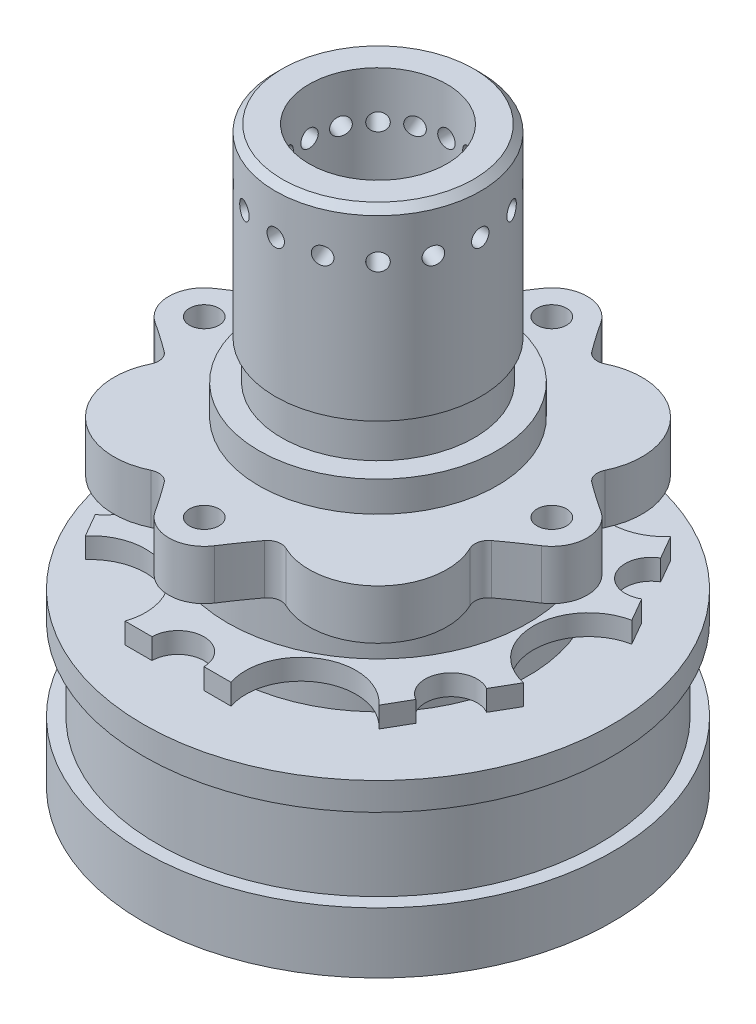
from build123d import *

# Parameters (mm, degrees)
SKETCH5_W                     = 15.875
SKETCH5_H                     = 132.08
SKETCH7_W                     = 3.4
SKETCH7_H                     = 69.85
DRIVE_PIN_HOLES_PATTERN_COUNT = 4
FLANGE_SUPPORT_CUT_REACH      = 105.468
SKETCH8_R                     = 52.5
BRAKE_START                   = 4.7625
BRAKE_HAT_HEX_DEPTH           = 4.7625
SKETCH14_R                    = 2
PIN_HOLES_DEPTH               = 104.467984179
PIN_HOLE_PATTERN_COUNT        = 16
FILLET1_R                     = 3.175
SKETCH17_R                    = 8.73125
CUT_EXTRUDE1_DEPTH            = 7.9375
SKETCH18_R                    = 6.746875
CUT_EXTRUDE2_DEPTH            = 1.27
CIRPATTERN2_COUNT             = 3
CUT_EXTRUDE3_DEPTH            = 34.29
FILLET2_R                     = 6.35


with BuildPart() as part:
    # Sketch1 → Bearing Shaft/Flange Support (revolve)
    with BuildSketch(Plane(origin=(0, 0, 0), x_dir=(0, 0, -1), z_dir=(1, 0, 0)), mode=Mode.PRIVATE) as bearing_shaft_flange_support_sk:
        Polygon((0, 0), (-34.6075, 0), (-34.6075, -12.319), (-47.625, -12.319), (-47.625, -17.0815), (-34.6075, -17.0815), (-34.6075, -22.86), (-53.975, -22.86), (-53.975, -29.21), (-50.8, -29.21), (-50.8, -48.26), (-53.975, -48.26), (-53.975, -62.23), (0, -62.23), align=None)
    revolve(bearing_shaft_flange_support_sk.sketch.rotate(Axis((0, 0, 0), (0, 1, 0)), 180), axis=Axis((0, 0, 0), (0, 1, 0)))

    # Sketch2 → Drive Pin Support (revolve)
    with BuildSketch(Plane(origin=(0, 0, 0), x_dir=(0, 0, -1), z_dir=(1, 0, 0)), mode=Mode.PRIVATE) as drive_pin_support_sk:
        Polygon((0, 0), (-52.5, 0), (-52.5, 11.43), (-27.4096, 11.43), (-27.4096, 18.43), (-22.225, 18.43), (-22.225, 27.305), (-23.61946, 27.305), (-23.61946, 68.2625), (-22.03196, 69.85), (0, 69.85), align=None)
    revolve(drive_pin_support_sk.sketch.rotate(Axis((0, 0, 0), (0, 1, 0)), 180), axis=Axis((0, 0, 0), (0, 1, 0)))

    # Sketch5 → Center Mass Removal (revolve, cut)
    with BuildSketch(Plane(origin=(0, 0, 0), x_dir=(0, 0, -1), z_dir=(1, 0, 0)), mode=Mode.PRIVATE) as center_mass_removal_sk:
        with Locations((7.9375, 3.81)):
            Rectangle(SKETCH5_W, SKETCH5_H)
    revolve(center_mass_removal_sk.sketch.rotate(Axis((0, 0, 0), (0, -1, 0)), 180), axis=Axis((0, 0, 0), (0, -1, 0)), mode=Mode.SUBTRACT)

    # Sketch7 → Drive Pin Holes (revolve, cut)
    with BuildSketch(Plane(origin=(0, 0, 40), x_dir=(0, 0, -1), z_dir=(1, 0, 0))):
        with Locations((1.7, 34.925)):
            Rectangle(SKETCH7_W, SKETCH7_H)
    drive_pin_holes = revolve(axis=Axis((0, -6.35, 40), (0, 1, 0)), mode=Mode.SUBTRACT)

    # Drive Pin Holes Pattern: Drive Pin Holes ×4 about axis
    drive_pin_holes_pattern_axis = Axis((0, 0, 0), (0, 1, 0))
    for i in range(1, DRIVE_PIN_HOLES_PATTERN_COUNT):
        add(drive_pin_holes.rotate(drive_pin_holes_pattern_axis, i * 360 / DRIVE_PIN_HOLES_PATTERN_COUNT), mode=Mode.SUBTRACT)

    # Sketch8 → Flange Support Cut (cut, up to next)
    with BuildSketch(Plane.XZ, mode=Mode.PRIVATE) as flange_support_cut_sk1:
        Circle(SKETCH8_R)
        with BuildLine():
            ThreePointArc((6.851776468, 44.436165629), (0, 48.1625), (-6.851776468, 44.436165629))
            ThreePointArc((-6.851776468, 44.436165629), (-9.964767607, 39.850591878), (-13.274865482, 35.405206349))
            ThreePointArc((-13.274865482, 35.405206349), (-33.675960454, 33.675960454), (-35.405206349, 13.274865482))
            ThreePointArc((-35.405206349, 13.274865482), (-39.850591878, 9.964767607), (-44.436165629, 6.851776468))
            ThreePointArc((-44.436165629, 6.851776468), (-48.1625, 0), (-44.436165629, -6.851776468))
            ThreePointArc((-44.436165629, -6.851776468), (-39.850591878, -9.964767607), (-35.405206349, -13.274865482))
            ThreePointArc((-35.405206349, -13.274865482), (-33.675960454, -33.675960454), (-13.274865482, -35.405206349))
            ThreePointArc((-13.274865482, -35.405206349), (-9.964767607, -39.850591878), (-6.851776468, -44.436165629))
            ThreePointArc((-6.851776468, -44.436165629), (0, -48.1625), (6.851776468, -44.436165629))
            ThreePointArc((6.851776468, -44.436165629), (9.964767607, -39.850591878), (13.274865482, -35.405206349))
            ThreePointArc((13.274865482, -35.405206349), (33.675960454, -33.675960454), (35.405206349, -13.274865482))
            ThreePointArc((35.405206349, -13.274865482), (39.850591878, -9.964767607), (44.436165629, -6.851776468))
            ThreePointArc((44.436165629, -6.851776468), (48.1625, 0), (44.436165629, 6.851776468))
            ThreePointArc((44.436165629, 6.851776468), (39.850591878, 9.964767607), (35.405206349, 13.274865482))
            ThreePointArc((35.405206349, 13.274865482), (33.675960454, 33.675960454), (13.274865482, 35.405206349))
            ThreePointArc((13.274865482, 35.405206349), (9.964767607, 39.850591878), (6.851776468, 44.436165629))
        make_face(mode=Mode.SUBTRACT)
    flange_support_cut_tool1 = extrude(flange_support_cut_sk1.sketch, amount=-FLANGE_SUPPORT_CUT_REACH, mode=Mode.PRIVATE) & part.part
    add(flange_support_cut_tool1.solids().sort_by_distance((-51.015076, 0, 0))[0], mode=Mode.SUBTRACT)

    # Sketch10 → Brake Hat Hex (cut)
    with BuildSketch(Plane.XZ.offset(12.319).offset(BRAKE_START)):
        with BuildLine():
            ThreePointArc((5.969, -46.0375), (0.002019456, -40.068500342), (-5.968998634, -46.033461088))
            Line((-5.968998634, -46.033461088), (-12.209057508, -46.033461088))
            ThreePointArc((-12.209057508, -46.033461088), (-0.007882397, -47.624999348), (12.193818875, -46.0375))
            Line((12.193818875, -46.0375), (5.969, -46.0375))
        make_face()
        with BuildLine():
            ThreePointArc((-33.772735089, -33.578906915), (-23.81932603, -41.240518092), (-12.209057508, -46.033461088))
            ThreePointArc((-12.209057508, -46.033461088), (-17.890731283, -30.975814606), (-33.772735089, -33.578906915))
        make_face()
        with BuildLine():
            ThreePointArc((-45.970675481, -12.443376586), (-41.248400489, -23.805673317), (-33.772735089, -33.578906915))
            Line((-33.772735089, -33.578906915), (-36.885144527, -28.188055635))
            ThreePointArc((-36.885144527, -28.188055635), (-34.699329459, -20.035999071), (-42.850646043, -17.847426092))
            Line((-42.850646043, -17.847426092), (-45.970675481, -12.443376586))
        make_face()
        with BuildLine():
            ThreePointArc((33.761617972, -33.590084503), (17.88047671, -30.981735086), (12.193818875, -46.0375))
            ThreePointArc((12.193818875, -46.0375), (23.805673317, -41.248400489), (33.761617972, -33.590084503))
        make_face()
        with BuildLine():
            ThreePointArc((-45.966553964, 12.458593085), (-47.624999348, 0.007882397), (-45.970675481, -12.443376586))
            ThreePointArc((-45.970675481, -12.443376586), (-35.771207993, 0.005920481), (-45.966553964, 12.458593085))
        make_face()
        with BuildLine():
            Line((36.88164741, -28.186034996), (33.761617972, -33.590084503))
            ThreePointArc((33.761617972, -33.590084503), (41.240518092, -23.81932603), (45.966553964, -12.458593085))
            Line((45.966553964, -12.458593085), (42.854144527, -17.849444365))
            ThreePointArc((42.854144527, -17.849444365), (34.701348915, -20.032501271), (36.88164741, -28.186034996))
        make_face()
        with BuildLine():
            ThreePointArc((-33.761617972, 33.590084503), (-41.240518092, 23.81932603), (-45.966553964, 12.458593085))
            Line((-45.966553964, 12.458593085), (-42.854144527, 17.849444365))
            ThreePointArc((-42.854144527, 17.849444365), (-34.701348915, 20.032501271), (-36.88164741, 28.186034996))
            Line((-36.88164741, 28.186034996), (-33.761617972, 33.590084503))
        make_face()
        with BuildLine():
            ThreePointArc((45.970675481, 12.443376586), (35.771207993, -0.005920481), (45.966553964, -12.458593085))
            ThreePointArc((45.966553964, -12.458593085), (47.624999348, -0.007882397), (45.970675481, 12.443376586))
        make_face()
        with BuildLine():
            ThreePointArc((-12.193818875, 46.0375), (-23.805673317, 41.248400489), (-33.761617972, 33.590084503))
            ThreePointArc((-33.761617972, 33.590084503), (-17.88047671, 30.981735086), (-12.193818875, 46.0375))
        make_face()
        with BuildLine():
            Line((42.850646043, 17.847426092), (45.970675481, 12.443376586))
            ThreePointArc((45.970675481, 12.443376586), (41.248400489, 23.805673317), (33.772735089, 33.578906915))
            Line((33.772735089, 33.578906915), (36.885144527, 28.188055635))
            ThreePointArc((36.885144527, 28.188055635), (34.699329459, 20.035999071), (42.850646043, 17.847426092))
        make_face()
        with BuildLine():
            ThreePointArc((12.209057508, 46.033461088), (0.007882397, 47.624999348), (-12.193818875, 46.0375))
            Line((-12.193818875, 46.0375), (-5.969, 46.0375))
            ThreePointArc((-5.969, 46.0375), (-0.002019456, 40.068500342), (5.968998634, 46.033461088))
            Line((5.968998634, 46.033461088), (12.209057508, 46.033461088))
        make_face()
        with BuildLine():
            ThreePointArc((12.209057508, 46.033461088), (17.890731283, 30.975814606), (33.772735089, 33.578906915))
            ThreePointArc((33.772735089, 33.578906915), (23.81932603, 41.240518092), (12.209057508, 46.033461088))
        make_face()
    extrude(amount=-BRAKE_HAT_HEX_DEPTH, mode=Mode.SUBTRACT)

    # Sketch14 → Pin Holes (cut, through all)
    with BuildSketch(Plane(origin=(0, 0, 0), x_dir=(0, 0, -1), z_dir=(1, 0, 0))):
        with Locations((0, 59.05)):
            Circle(SKETCH14_R)
    pin_holes = extrude(amount=-PIN_HOLES_DEPTH, mode=Mode.SUBTRACT)

    # Pin Hole Pattern: Pin Holes ×16 about axis
    pin_hole_pattern_axis = Axis((0, 0, 0), (0, -1, 0))
    for i in range(1, PIN_HOLE_PATTERN_COUNT):
        add(pin_holes.rotate(pin_hole_pattern_axis, i * 360 / PIN_HOLE_PATTERN_COUNT), mode=Mode.SUBTRACT)

    # Fillet1
    fillet1_edges = [part.edges().sort_by_distance(p)[0] for p in [
        (-35.405206349, 5.715, -13.274865482),
        (-13.274865482, 5.715, -35.405206349),
        (13.274865482, 5.715, -35.405206349),
        (35.405206349, 5.715, -13.274865482),
        (35.405206349, 5.715, 13.274865482),
        (13.274865482, 5.715, 35.405206349),
        (-13.274865482, 5.715, 35.405206349),
        (-35.405206349, 5.715, 13.274865482),
    ]]
    fillet(fillet1_edges, radius=FILLET1_R)

    # Sketch17 → Cut-Extrude1 (cut)
    with BuildSketch(Plane.XZ.offset(62.23)):
        with Locations(Location((0, 39.158333333, 0), (0, 0, 270))):
            Circle(SKETCH17_R)
        with Locations(Location((33.912111437, -19.579166667, 0), (0, 0, 270))):
            Circle(SKETCH17_R)
        with Locations(Location((-33.912111437, -19.579166667, 0), (0, 0, 270))):
            Circle(SKETCH17_R)
    extrude(amount=-CUT_EXTRUDE1_DEPTH, mode=Mode.SUBTRACT)

    # Sketch18 → Cut-Extrude2 (cut)
    with BuildSketch(Plane.XZ.offset(54.2925)):
        with Locations(Location((0, 39.158333333, 0), (0, 0, 270))):
            Circle(SKETCH18_R)
        with Locations(Location((33.912111437, -19.579166667, 0), (0, 0, 270))):
            Circle(SKETCH18_R)
        with Locations(Location((-33.912111437, -19.579166667, 0), (0, 0, 270))):
            Circle(SKETCH18_R)
    extrude(amount=-CUT_EXTRUDE2_DEPTH, mode=Mode.SUBTRACT)

    # Sketch21 → 1/4-20 Tapped Hole2 (revolve, cut)
    with BuildSketch(Plane(origin=(0, -53.0225, 39.158333333), x_dir=(0, 0, -1), z_dir=(1, 0, 0))):
        Polygon((0, 0), (0, 25.663816902), (2.5527, 24.13), (2.5527, 0), align=None)
    f_1_4_20_tapped_hole2 = revolve(axis=Axis((0, -59.3725, 39.158333333), (0, 1, 0)), mode=Mode.SUBTRACT)

    # CirPattern2: 1/4-20 Tapped Hole2 ×3 about axis
    cirpattern2_axis = Axis((0, 0, 0), (0, 1, 0))
    for i in range(1, CIRPATTERN2_COUNT):
        add(f_1_4_20_tapped_hole2.rotate(cirpattern2_axis, i * 360 / CIRPATTERN2_COUNT), mode=Mode.SUBTRACT)

    # Sketch22 → Cut-Extrude3 (cut)
    with BuildSketch(Plane.XZ.offset(62.23)):
        with BuildLine():
            ThreePointArc((21.214893058, 39.060604354), (38.494829198, 22.225), (44.434922187, -1.15766585))
            ThreePointArc((44.434922187, -1.15766585), (41.989886104, -6.00133428), (36.695421252, -7.187912232))
            ThreePointArc((36.695421252, -7.187912232), (33.276371905, -6.895088645), (29.903737353, -7.52831868))
            ThreePointArc((29.903737353, -7.52831868), (24.047770019, -6.55128934), (21.558743422, -1.161327712))
            ThreePointArc((21.558743422, -1.161327712), (18.697488468, 10.795), (9.77363241, 19.251083333))
            ThreePointArc((9.77363241, 19.251083333), (6.350302014, 24.101624411), (8.432153452, 29.661555556))
            ThreePointArc((8.432153452, 29.661555556), (10.666864024, 32.265727738), (12.122796033, 35.373123123))
            ThreePointArc((12.122796033, 35.373123123), (15.797635109, 39.364975208), (21.214893058, 39.060604354))
        make_face()
        with BuildLine():
            ThreePointArc((21.471583901, -22.133236876), (22.609507881, -25.370639092), (24.572625219, -28.185210891))
            ThreePointArc((24.572625219, -28.185210891), (26.192250995, -33.363640928), (23.220029129, -37.902938504))
            ThreePointArc((23.220029129, -37.902938504), (0, -44.45), (-23.220029129, -37.902938504))
            ThreePointArc((-23.220029129, -37.902938504), (-26.192250995, -33.363640928), (-24.572625219, -28.185210891))
            ThreePointArc((-24.572625219, -28.185210891), (-22.609507881, -25.370639092), (-21.471583901, -22.133236876))
            ThreePointArc((-21.471583901, -22.133236876), (-17.697468005, -17.550335071), (-11.785111012, -18.089755621))
            ThreePointArc((-11.785111012, -18.089755621), (0, -21.59), (11.785111012, -18.089755621))
            ThreePointArc((11.785111012, -18.089755621), (17.697468005, -17.550335071), (21.471583901, -22.133236876))
        make_face()
        with BuildLine():
            ThreePointArc((-29.903737353, -7.52831868), (-33.276371905, -6.895088645), (-36.695421252, -7.187912232))
            ThreePointArc((-36.695421252, -7.187912232), (-41.989886104, -6.00133428), (-44.434922187, -1.15766585))
            ThreePointArc((-44.434922187, -1.15766585), (-38.494829198, 22.225), (-21.214893058, 39.060604354))
            ThreePointArc((-21.214893058, 39.060604354), (-15.797635109, 39.364975208), (-12.122796033, 35.373123123))
            ThreePointArc((-12.122796033, 35.373123123), (-10.666864024, 32.265727738), (-8.432153452, 29.661555556))
            ThreePointArc((-8.432153452, 29.661555556), (-6.350302014, 24.101624411), (-9.77363241, 19.251083333))
            ThreePointArc((-9.77363241, 19.251083333), (-18.697488468, 10.795), (-21.558743422, -1.161327712))
            ThreePointArc((-21.558743422, -1.161327712), (-24.047770019, -6.55128934), (-29.903737353, -7.52831868))
        make_face()
    extrude(amount=-CUT_EXTRUDE3_DEPTH, mode=Mode.SUBTRACT)

    # Fillet2
    fillet2_edges = [part.edges().sort_by_distance(p)[0] for p in [
        (-6.350302014, -27.94, 24.101624411),
        (-18.697488468, -27.94, 10.795),
        (-24.047770019, -27.94, -6.55128934),
        (-33.276371905, -27.94, -6.895088645),
        (-41.989886104, -27.94, -6.00133428),
        (-38.494829198, -27.94, 22.225),
        (-15.797635109, -27.94, 39.364975208),
        (-10.666864024, -27.94, 32.265727738),
        (-17.697468005, -27.94, -17.550335071),
        (0, -27.94, -21.59),
        (17.697468005, -27.94, -17.550335071),
        (22.609507881, -27.94, -25.370639092),
        (26.192250995, -27.94, -33.363640928),
        (0, -27.94, -44.45),
        (-26.192250995, -27.94, -33.363640928),
        (-22.609507881, -27.94, -25.370639092),
        (24.047770019, -27.94, -6.55128934),
        (18.697488468, -27.94, 10.795),
        (6.350302014, -27.94, 24.101624411),
        (10.666864024, -27.94, 32.265727738),
        (15.797635109, -27.94, 39.364975208),
        (38.494829198, -27.94, 22.225),
        (41.989886104, -27.94, -6.00133428),
        (33.276371905, -27.94, -6.895088645),
    ]]
    fillet(fillet2_edges, radius=FILLET2_R)


solid = part.part
